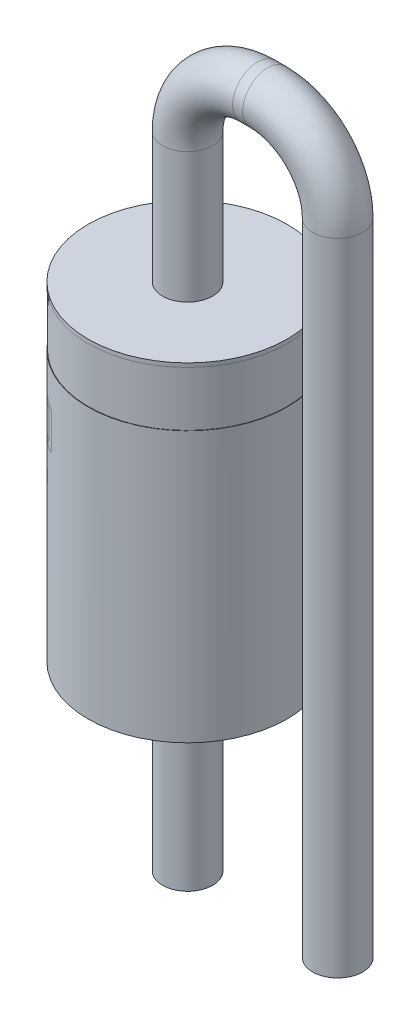
from build123d import *

# Parameters (mm, degrees)
SKETCH1_R     = 2.525
BODY_DEPTH    = 4.175
CATHODE_START = 0.1
SKETCH8_R     = 2.535
SKETCH8_R_2   = 2.515
CATHODE_DEPTH = 1.391666667
SKETCH6_R     = 0.635


with BuildPart() as part:
    # Sketch1 → BODY (new, symmetric)
    with BuildSketch(Plane(origin=(0, 6.175, 0), x_dir=(1, 0, 0), z_dir=(0, 1, 0))):
        Circle(SKETCH1_R)
    extrude(amount=BODY_DEPTH, both=True)

    # Sketch8 → CATHODE (cut)
    with BuildSketch(Plane(origin=(0, 10.35, 0), x_dir=(0, 0, 1), z_dir=(0, -1, 0)).offset(CATHODE_START)):
        Circle(SKETCH8_R)
        Circle(SKETCH8_R_2, mode=Mode.SUBTRACT)
    extrude(amount=CATHODE_DEPTH, mode=Mode.SUBTRACT)

    # PINS: sweep along a path in Sketch7
    with BuildLine(Plane.XY) as pins_path:
        Line((0, -2.6), (0, 13.655124131))
        ThreePointArc((0, 13.655124131), (0.520764143, 14.912359988), (1.778, 15.433124131))
        Line((1.778, 15.433124131), (2.032, 15.433124131))
        ThreePointArc((2.032, 15.433124131), (3.289235857, 14.912359988), (3.81, 13.655124131))
        Line((3.81, 13.655124131), (3.81, -2.6))
    # Sketch6 → PINS (sweep)
    with BuildSketch(Plane(origin=(0, 6.175, 0), x_dir=(1, 0, 0), z_dir=(0, 1, 0))):
        Circle(SKETCH6_R)
    sweep(path=pins_path.line)


solid = part.part
